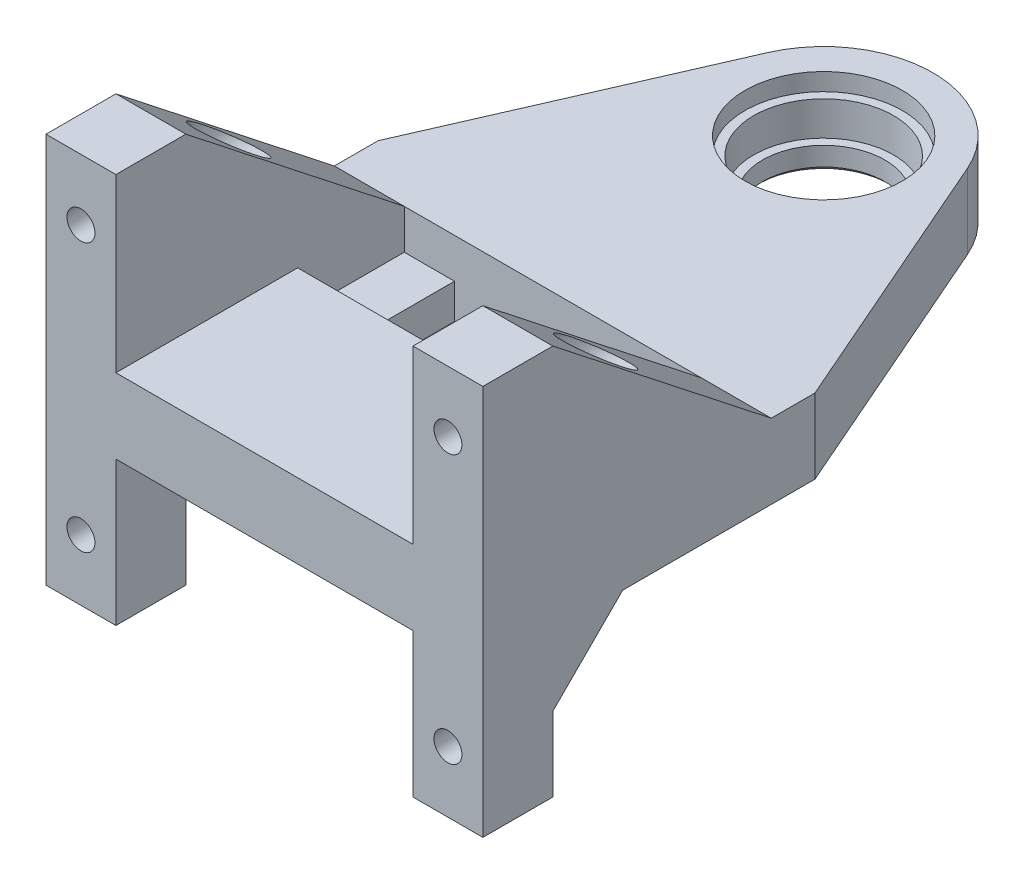
from build123d import *

# Parameters (mm, degrees)
SKETCH1_R           = 7
SKETCH1_W           = 22.5
SKETCH1_H           = 12.2
BOSS_EXTRUDE1_DEPTH = 8.55
SKETCH2_W           = 34
SKETCH2_H           = 12.2
CUT_EXTRUDE1_DEPTH  = 4.55
SKETCH3_R           = 9
CUT_EXTRUDE2_DEPTH  = 2
SKETCH4_R           = 8
CUT_EXTRUDE3_DEPTH  = 3.9
CHAMFER1_SIZE       = 0.5
BOSS_EXTRUDE2_DEPTH = 8
SKETCH6_R           = 1.6
CUT_EXTRUDE4_DEPTH  = 5
CUT_EXTRUDE5_REACH  = 82.824
SKETCH7_R           = 3
SKETCH8_W           = 8
SKETCH8_H           = 16.5
BOSS_EXTRUDE3_DEPTH = 8
CHAMFER2_SIZE       = 8


# Read off the part's stored shape, not the designer's step: Mirror3
with BuildPart() as part:
    # Sketch1 → Boss-Extrude1 (new body)
    with BuildSketch(Plane(origin=(0, 0, 0), x_dir=(1, 0, 0), z_dir=(0, 1, 0))):
        with BuildLine():
            Line((-25, 19), (-11.454535097, 50.00436067))
            ThreePointArc((-11.454535097, 50.00436067), (0, 57.5), (11.454535097, 50.00436067))
            Line((11.454535097, 50.00436067), (25, 19))
            Line((25, 19), (25, -19))
            Line((25, -19), (-25, -19))
            Line((-25, -19), (-25, 19))
        make_face()
        with Locations(Location((0, 45, 0), (0, 0, 270))):
            Circle(SKETCH1_R, mode=Mode.SUBTRACT)
        with Locations((0, 7.9)):
            Rectangle(SKETCH1_W, SKETCH1_H, mode=Mode.SUBTRACT)
    extrude(amount=BOSS_EXTRUDE1_DEPTH)

    # Sketch2 → Cut-Extrude1 (cut)
    with BuildSketch(Plane(origin=(0, 8.55, 0), x_dir=(1, 0, 0), z_dir=(0, 1, 0))):
        with Locations((0, 7.9)):
            Rectangle(SKETCH2_W, SKETCH2_H)
    extrude(amount=-CUT_EXTRUDE1_DEPTH, mode=Mode.SUBTRACT)

    # Sketch3 → Cut-Extrude2 (cut)
    with BuildSketch(Plane(origin=(0, 8.55, 0), x_dir=(1, 0, 0), z_dir=(0, 1, 0))):
        with Locations(Location((0, 45, 0), (0, 0, 270))):
            Circle(SKETCH3_R)
    extrude(amount=-CUT_EXTRUDE2_DEPTH, mode=Mode.SUBTRACT)

    # Sketch4 → Cut-Extrude3 (cut)
    with BuildSketch(Plane(origin=(0, 6.55, 0), x_dir=(1, 0, 0), z_dir=(0, 1, 0))):
        with Locations(Location((0, 45, 0), (0, 0, 270))):
            Circle(SKETCH4_R)
    extrude(amount=-CUT_EXTRUDE3_DEPTH, mode=Mode.SUBTRACT)

    # Chamfer1
    chamfer1_edges = [part.edges().sort_by_distance(p)[0] for p in [
        (0, 0, -52),
    ]]
    chamfer(chamfer1_edges, length=CHAMFER1_SIZE)

    # Sketch5 → Boss-Extrude2 (add)
    with BuildSketch(Plane.ZY.offset(25)):
        Polygon((19, 8.55), (19, 28.2), (11, 28.2), (-14, 8.55), align=None)
    extrude(amount=-BOSS_EXTRUDE2_DEPTH)

    # Sketch6 → Cut-Extrude4 (cut)
    with BuildSketch(Plane.XY.offset(19)):
        with Locations((-21, 21.2)):
            Circle(SKETCH6_R)
    cut_extrude4 = extrude(amount=-CUT_EXTRUDE4_DEPTH, mode=Mode.SUBTRACT)

    # Cut-Extrude5: up to this plane
    cut_extrude5_end = Plane(origin=(-17, 28.2, 11), z_dir=(0, 0.7862091997273701, -0.617960430985713))
    # Sketch7 → Cut-Extrude5 (cut, up to the surface)
    with BuildSketch(Plane.XY.offset(14), mode=Mode.PRIVATE) as cut_extrude5_sk1:
        with Locations((-21, 21.2)):
            Circle(SKETCH7_R)
    cut_extrude5_tool1 = split(extrude(cut_extrude5_sk1.sketch, amount=-CUT_EXTRUDE5_REACH, mode=Mode.PRIVATE), bisect_by=cut_extrude5_end, keep=Keep.BOTH, mode=Mode.PRIVATE)
    cut_extrude5 = cut_extrude5_tool1.solids().sort_by_distance((-21, 21.2, 14))[0]
    add(cut_extrude5, mode=Mode.SUBTRACT)

    # Sketch8 → Boss-Extrude3 (add)
    with BuildSketch(Plane.ZY.offset(25)):
        with Locations((15, -8.25)):
            Rectangle(SKETCH8_W, SKETCH8_H)
    extrude(amount=-BOSS_EXTRUDE3_DEPTH)

    # Chamfer2
    chamfer2_edges = [part.edges().sort_by_distance(p)[0] for p in [
        (-21, 0, 11),
    ]]
    chamfer(chamfer2_edges, length=CHAMFER2_SIZE)

    # Mirror2: Cut-Extrude4, Cut-Extrude5 across plane
    add(cut_extrude4.mirror(Plane.ZX.offset(5.85)), mode=Mode.SUBTRACT)
    add(cut_extrude5.mirror(Plane.ZX.offset(5.85)), mode=Mode.SUBTRACT)

    # Mirror3: part across plane


with BuildPart() as part_1:
    add(part.part)
    add(part.part.mirror(Plane(origin=(0, 0, 0), x_dir=(0, 0, 1), z_dir=(1, 0, 0))))


solid = part_1.part
